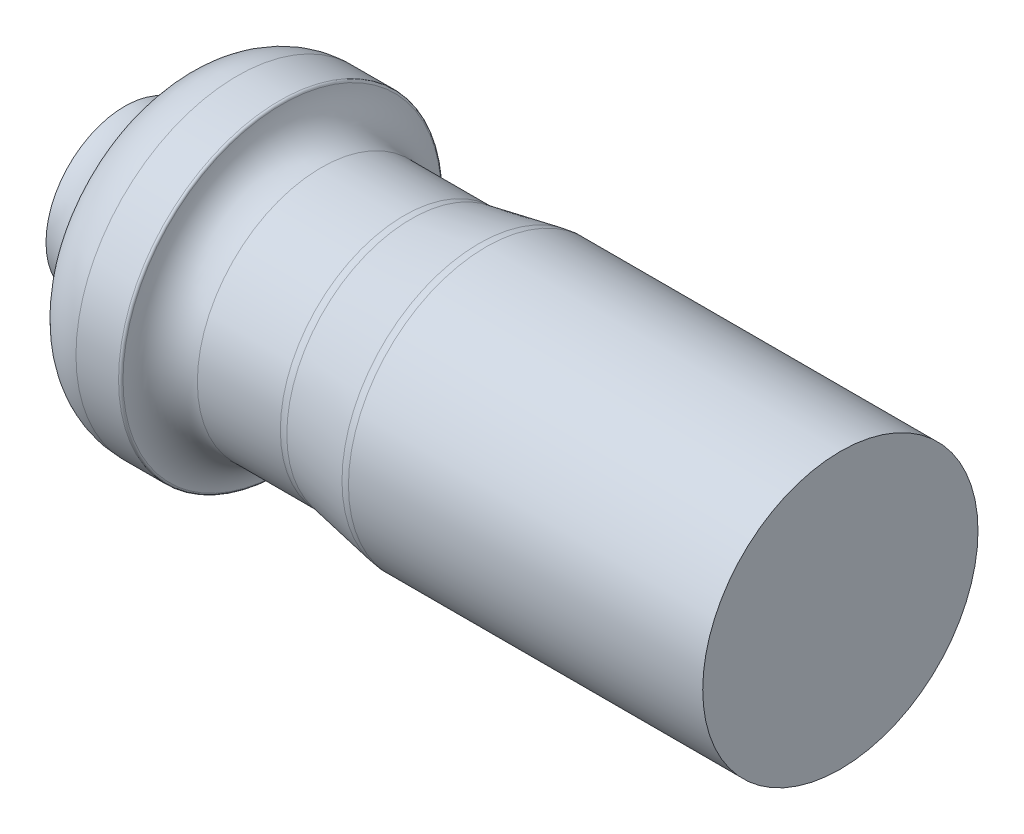
from build123d import *

# Parameters (mm, degrees)
FILLET1_R = 5
FILLET2_R = 0.3
FILLET3_R = 5


with BuildPart() as part:
    # Sketch3 → Revolve1 (revolve)
    with BuildSketch(Plane.XY, mode=Mode.PRIVATE) as revolve1_sk:
        with BuildLine():
            Line((45.5, 0), (45.5, 17.499999999999996))
            Line((45.5, 17.499999999999996), (0, 17.500000000006253))
            Line((0, 17.500000000006253), (-9.5, 15.75))
            Line((-9.5, 15.75), (-25.499999999999996, 15.749999999999996))
            Line((-25.499999999999996, 15.749999999999996), (-25.499999999999996, 20.5))
            Line((-25.499999999999996, 20.5), (-31.190911978745817, 20.5))
            ThreePointArc((-31.190911978745817, 20.5), (-35.92377580522551, 18.949806198638836), (-38.82242559008138, 14.9))
            ThreePointArc((-38.82242559008138, 14.9), (-41.358744151830265, 11.356419576191016), (-45.5, 10))
            Line((-45.5, 10), (-45.5, 0))
            Line((-45.5, 0), (45.5, 0))
        make_face()
    revolve(revolve1_sk.sketch.rotate(Axis((0, 0, 0), (1, 0, 0)), 90), axis=Axis((0, 0, 0), (1, 0, 0)))

    # Fillet1
    # the kernel refuses this fillet: 5 mm, written as the material it adds along each edge
    with BuildSketch(Plane(origin=(-25.499999999999996, 0, 0), x_dir=(0, 1.1e-16, 1), z_dir=(0, 1, -1.1e-16))) as fillet1_piece_1:
        with BuildLine():
            CenterArc((20.75, 4.993746088859542), FILLET1_R, 180, 87.13401601740111)
            Line((20.5, -3.55e-15), (20.495, -0.09987492177719304))
            ThreePointArc((20.495, -0.09987492177719304), (18.125, -0.10000000000000142), (15.749999999999996, -0.10000000000000142))
            Line((15.749999999999996, -0.10000000000000142), (15.649999999999997, 0))
            Line((15.649999999999997, 0), (15.65, 4.993746088859542))
            Line((15.65, 4.993746088859542), (15.75, 4.993746088859542))
        make_face()
    revolve(axis=Axis((-25.499999999999996, 0, 0), (1, 0, 0)))

    # Fillet2
    fillet2_edges = [part.edges().sort_by_distance(p)[0] for p in [
        (-25.499999999999996, -1.389e-14, -20.5),
    ]]
    fillet(fillet2_edges, radius=FILLET2_R)

    # Fillet3
    fillet3_edges = [part.edges().sort_by_distance(p)[0] for p in [
        (0, -4.09e-15, -17.500000000006253),
        (-9.5, -3.68e-15, -15.75),
    ]]
    fillet(fillet3_edges, radius=FILLET3_R)


solid = part.part
